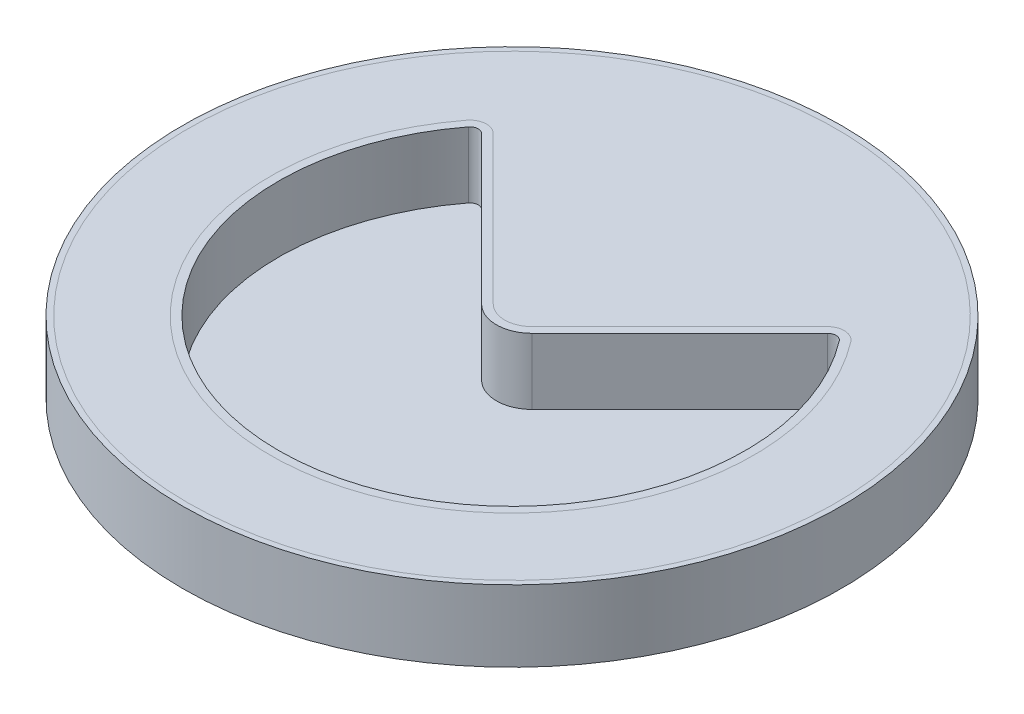
from build123d import *

# Parameters (mm, degrees)
SKETCH1_R             = 60
SKETCH1_R_2           = 57.5
EXTRUDE_THIN1_DEPTH   = 12
EXTRUDE_THIN1_2_DEPTH = 12
BOSS_EXTRUDE1_START   = -1
SKETCH2_R             = 60
BOSS_EXTRUDE1_DEPTH   = 1
SKETCH5_R             = 59
CUT_EXTRUDE1_DEPTH    = 1
SKETCH4_R             = 59
BOSS_EXTRUDE3_DEPTH   = 1


with BuildPart() as part:
    # Sketch1 → Extrude-Thin1 (new body)
    with BuildSketch(Plane(origin=(0, 0, 0), x_dir=(1, 0, 0), z_dir=(0, 1, 0))):
        Circle(SKETCH1_R)
        Circle(SKETCH1_R_2, mode=Mode.SUBTRACT)
    extrude(amount=EXTRUDE_THIN1_DEPTH)



with BuildPart() as body_2:
    # Sketch1 → Extrude-Thin1 2 (new body)
    with BuildSketch(Plane(origin=(0, 0, 0), x_dir=(1, 0, 0), z_dir=(0, 1, 0))):
        with BuildLine():
            Line((-29.737486768, 27.737486768), (-2.828427125, 0.828427125))
            ThreePointArc((-2.828427125, 0.828427125), (0, -0.343145751), (2.828427125, 0.828427125))
            Line((2.828427125, 0.828427125), (29.737486768, 27.737486768))
            ThreePointArc((29.737486768, 27.737486768), (32.830602007, 28.900292561), (35.743076224, 27.339211804))
            ThreePointArc((35.743076224, 27.339211804), (0, -45), (-35.743076224, 27.339211804))
            ThreePointArc((-35.743076224, 27.339211804), (-32.830602007, 28.900292561), (-29.737486768, 27.737486768))
        make_face()
        with BuildLine():
            Line((-31.505253721, 25.969719815), (-4.596194078, -0.939339828))
            ThreePointArc((-4.596194078, -0.939339828), (0, -2.843145751), (4.596194078, -0.939339828))
            Line((4.596194078, -0.939339828), (31.505253721, 25.969719815))
            ThreePointArc((31.505253721, 25.969719815), (32.665171936, 26.405771988), (33.757349767, 25.820366704))
            ThreePointArc((33.757349767, 25.820366704), (0, -42.5), (-33.757349767, 25.820366704))
            ThreePointArc((-33.757349767, 25.820366704), (-32.665171936, 26.405771988), (-31.505253721, 25.969719815))
        make_face(mode=Mode.SUBTRACT)
    extrude(amount=EXTRUDE_THIN1_2_DEPTH)


with BuildPart() as part_1:
    add(part.part)

    add(body_2.part)  # Boss-Extrude1 merges body 2
    # Sketch2 → Boss-Extrude1 (add)
    with BuildSketch(Plane(origin=(0, 0, 0), x_dir=(1, 0, 0), z_dir=(0, 1, 0)).offset(BOSS_EXTRUDE1_START)):
        Circle(SKETCH2_R)
    extrude(amount=BOSS_EXTRUDE1_DEPTH)

    # Sketch5 → Cut-Extrude1 (cut)
    with BuildSketch(Plane(origin=(0, 12, 0), x_dir=(1, 0, 0), z_dir=(0, 1, 0))):
        Circle(SKETCH5_R)
        with BuildLine():
            Line((30.444593549, 27.030379987), (3.535533906, 0.121320344))
            ThreePointArc((3.535533906, 0.121320344), (0, -1.343145751), (-3.535533906, 0.121320344))
            Line((-3.535533906, 0.121320344), (-30.444593549, 27.030379987))
            ThreePointArc((-30.444593549, 27.030379987), (-32.764429979, 27.902484332), (-34.948785641, 26.731673764))
            ThreePointArc((-34.948785641, 26.731673764), (0, -44), (34.948785641, 26.731673764))
            ThreePointArc((34.948785641, 26.731673764), (32.764429979, 27.902484332), (30.444593549, 27.030379987))
        make_face(mode=Mode.SUBTRACT)
    extrude(amount=-CUT_EXTRUDE1_DEPTH, mode=Mode.SUBTRACT)


with BuildPart() as body_2_2:
    # Sketch4 → Boss-Extrude3 (new body)
    with BuildSketch(Plane(origin=(0, 12, 0), x_dir=(1, 0, 0), z_dir=(0, 1, 0))):
        Circle(SKETCH4_R)
        with BuildLine():
            Line((3.535533906, 0.121320344), (30.444593549, 27.030379987))
            ThreePointArc((30.444593549, 27.030379987), (32.764429979, 27.902484332), (34.948785641, 26.731673764))
            ThreePointArc((34.948785641, 26.731673764), (0, -44), (-34.948785641, 26.731673764))
            ThreePointArc((-34.948785641, 26.731673764), (-32.764429979, 27.902484332), (-30.444593549, 27.030379987))
            Line((-30.444593549, 27.030379987), (-3.535533906, 0.121320344))
            ThreePointArc((-3.535533906, 0.121320344), (0, -1.343145751), (3.535533906, 0.121320344))
        make_face(mode=Mode.SUBTRACT)
    extrude(amount=-BOSS_EXTRUDE3_DEPTH)


solid = Compound([part_1.part, body_2_2.part])
